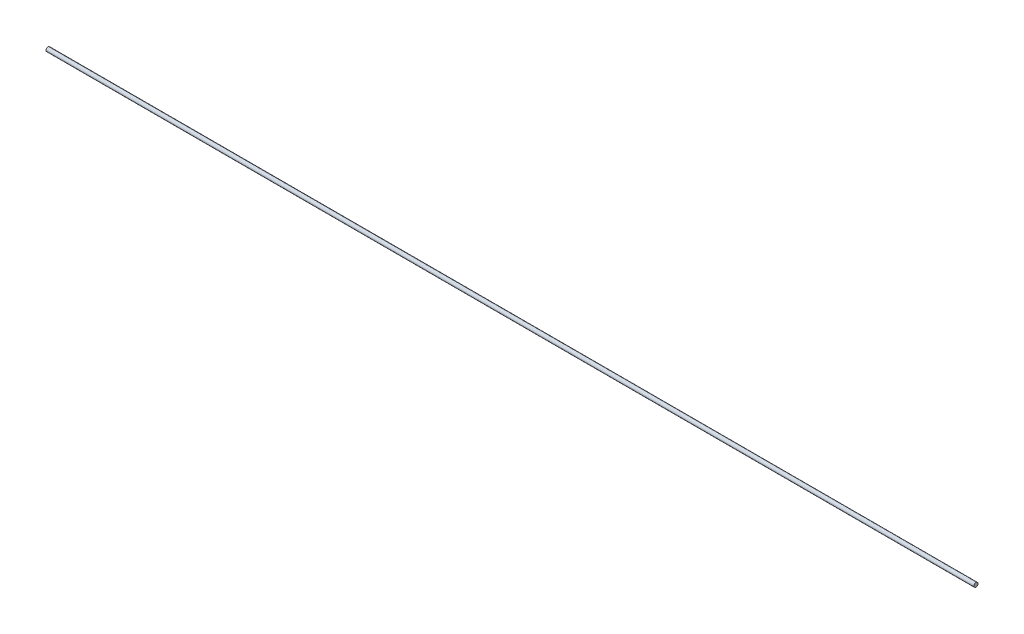
from build123d import *

# Parameters (mm, degrees)
SKETCH1_W = 1441.370509442
SKETCH1_H = 3.175


with BuildPart() as part:
    # Sketch1 → Revolve1 (revolve)
    with BuildSketch(Plane.XY):
        with Locations((720.685254721, 1.5875)):
            Rectangle(SKETCH1_W, SKETCH1_H)
    revolve(axis=Axis((0, 0, 0), (1, 0, 0)))


solid = part.part
